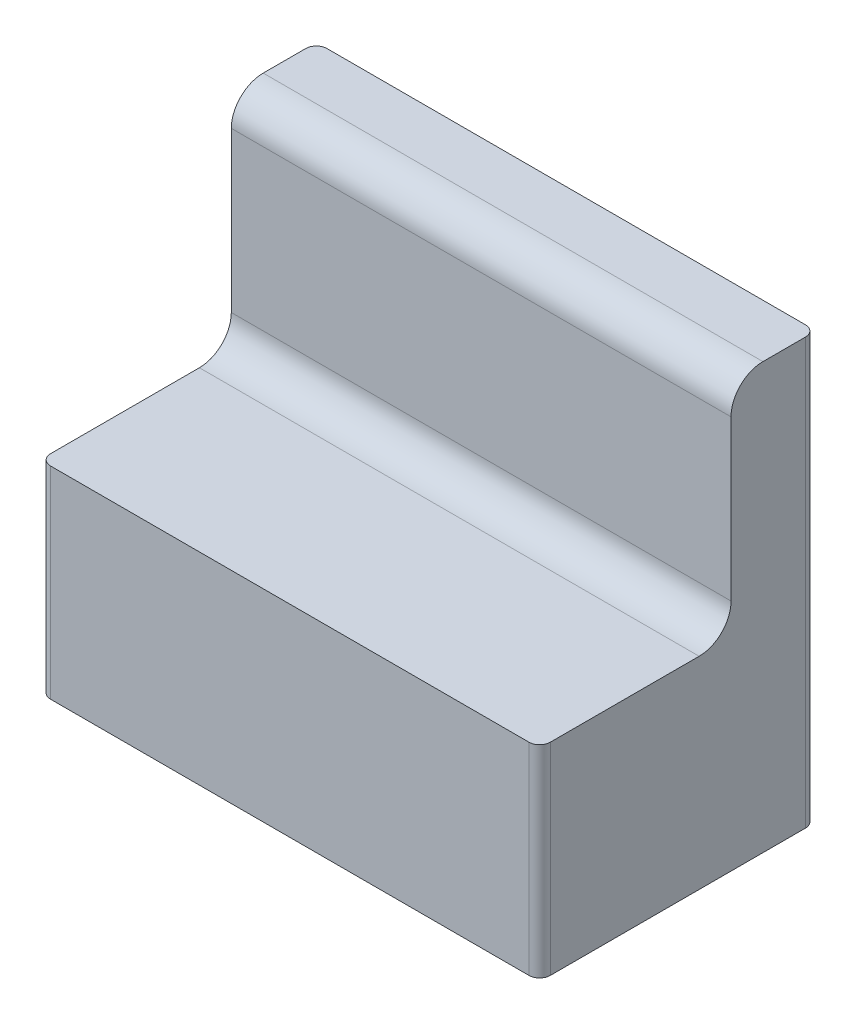
from build123d import *

# Parameters (mm, degrees)
SKETCH1_W                   = 47
SKETCH1_H                   = 26
BOSS_EXTRUDE1_DEPTH         = 40
CUT_EXTRUDE1_REACH          = 65.071
SKETCH2_W                   = 18
SKETCH2_H                   = 21
FILLET1_R                   = 3
M6_TAPPED_HOLE1_D           = 5
M6_TAPPED_HOLE1_DEPTH       = 15
M6_TAPPED_HOLE1_CSINK_D     = 6.05
M6_TAPPED_HOLE1_CSINK_ANGLE = 90
M6_TAPPED_HOLE1_TIP         = 1.502151548
FILLET2_R                   = 1


with BuildPart() as part:
    # Sketch1 → Boss-Extrude1 (new body)
    with BuildSketch(Plane(origin=(0, 0, 0), x_dir=(1, 0, 0), z_dir=(0, 1, 0))):
        Rectangle(SKETCH1_W, SKETCH1_H)
    extrude(amount=-BOSS_EXTRUDE1_DEPTH)

    # Sketch2 → Cut-Extrude1 (cut, up to next)
    with BuildSketch(Plane(origin=(23.5, 0, 0), x_dir=(0, 0, -1), z_dir=(1, 0, 0)), mode=Mode.PRIVATE) as cut_extrude1_sk1:
        with Locations((-4, -10.5)):
            Rectangle(SKETCH2_W, SKETCH2_H)
    cut_extrude1_tool1 = extrude(cut_extrude1_sk1.sketch, amount=-CUT_EXTRUDE1_REACH, mode=Mode.PRIVATE) & part.part
    add(cut_extrude1_tool1.solids().sort_by_distance((23.5, -10.5, 4))[0], mode=Mode.SUBTRACT)

    # Fillet1
    fillet1_edges = [part.edges().sort_by_distance(p)[0] for p in [
        (0, 0, -5),
        (0, -21, -5),
    ]]
    fillet(fillet1_edges, radius=FILLET1_R)

    # M6 Tapped Hole1
    with Locations(Plane(origin=(0, -40, 0), x_dir=(-1, 0, 0), z_dir=(0, -1, 0))):
        with Locations((-15.5, 0), (15.5, 0)):
            CounterSinkHole(M6_TAPPED_HOLE1_D / 2, M6_TAPPED_HOLE1_CSINK_D / 2, depth=M6_TAPPED_HOLE1_DEPTH, counter_sink_angle=M6_TAPPED_HOLE1_CSINK_ANGLE)
            with Locations((0, 0, -(M6_TAPPED_HOLE1_DEPTH + M6_TAPPED_HOLE1_TIP / 2))):  # 118° drill point
                Cone(0, M6_TAPPED_HOLE1_D / 2, M6_TAPPED_HOLE1_TIP, mode=Mode.SUBTRACT)

    # Fillet2
    fillet2_edges = [part.edges().sort_by_distance(p)[0] for p in [
        (23.5, -20, -13),
        (23.5, -30.5, 13),
        (-23.5, -30.5, 13),
        (-23.5, -20, -13),
    ]]
    fillet(fillet2_edges, radius=FILLET2_R)


solid = part.part
